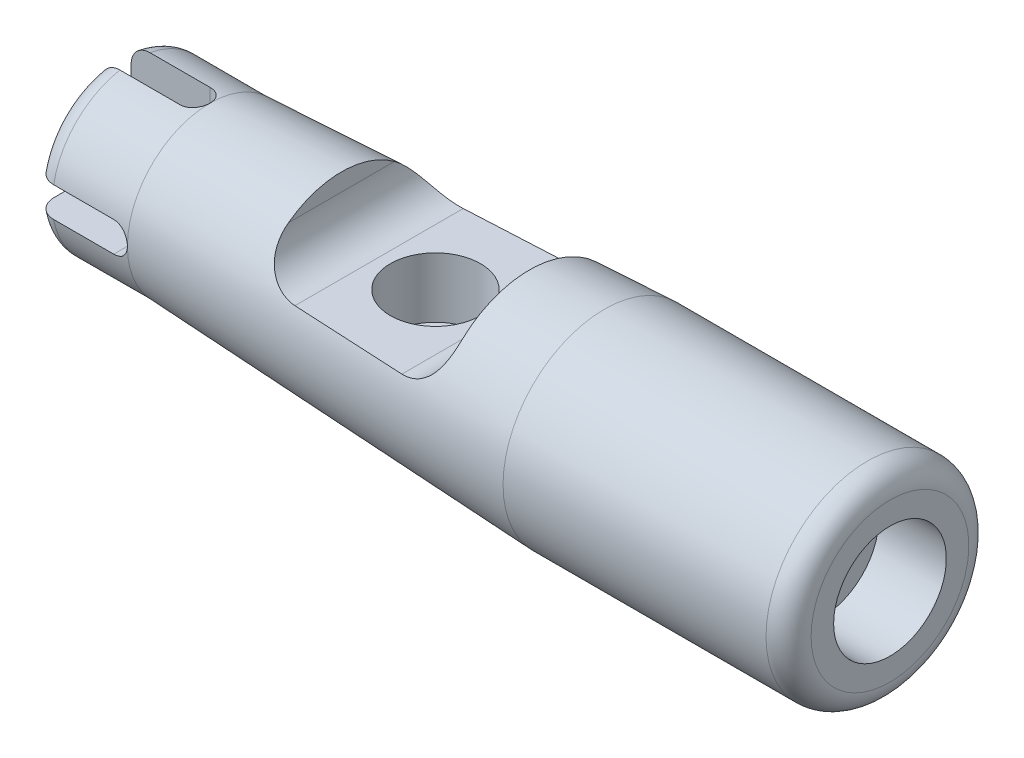
from build123d import *

# Parameters (mm, degrees)
CUT_EXTRUDE_1_DEPTH      = 173.313538512
PATTERN_CIRCULAR_1_COUNT = 4
CUT_EXTRUDE_2_DEPTH      = 173.313538512
CUT_EXTRUDE_2_DEPTH_BACK = 173.313538512
SKETCH_5_R               = 12
CUT_EXTRUDE_3_DEPTH      = 16
CUT_EXTRUDE_4_DEPTH      = 173.313538512
CUT_EXTRUDE_4_DEPTH_BACK = 173.313538512
SKETCH_6_W               = 60
SKETCH_6_H               = 5
SKETCH_7_R               = 3
CUT_EXTRUDE_5_DEPTH      = 12
FILLET_1_R               = 10
FILLET_2_R               = 6
FILLET_3_R               = 5
FILLET_4_R               = 5


with BuildPart() as part:
    # 草圖1 → 旋轉1 (revolve)
    with BuildSketch(Plane.XY, mode=Mode.PRIVATE) as revolve_1_sk:
        Polygon((92.029627014, 27), (-12.970372986, 22), (-37.970372986, 22), (-37.970372986, 0), (-12.970372986, 0), (92.029627014, 0), (168.029627014, 0), (168.029627014, 27), align=None)
    revolve(revolve_1_sk.sketch.rotate(Axis((-42.673460872, 0, 0), (1, 0, 0)), 90), axis=Axis((-42.673460872, 0, 0), (1, 0, 0)))

    # 草圖2 → 除料-伸長1 (cut, through all)
    with BuildSketch(Plane.XY):
        with BuildLine():
            Line((-37.970372986, -4), (-37.970372986, 4))
            Line((-37.970372986, 4), (-16.970372986, 4))
            ThreePointArc((-16.970372986, 4), (-12.970372986, 0), (-16.970372986, -4))
            Line((-16.970372986, -4), (-37.970372986, -4))
        make_face()
    cut_extrude_1 = extrude(amount=-CUT_EXTRUDE_1_DEPTH, mode=Mode.SUBTRACT)

    # 環狀複製排列1: 除料-伸長1 ×4 about axis
    pattern_circular_1_axis = Axis((0, 0, 0), (1, 0, 0))
    for i in range(1, PATTERN_CIRCULAR_1_COUNT):
        add(cut_extrude_1.rotate(pattern_circular_1_axis, i * 360 / PATTERN_CIRCULAR_1_COUNT), mode=Mode.SUBTRACT)

    # 草圖4 → 除料-伸長2 (cut, two sides: drawn at the far end of the back side and taken through both)
    with BuildSketch(Plane.XY.offset(-CUT_EXTRUDE_2_DEPTH_BACK)):
        Polygon((22.029627014, 23.666666667), (22.029627014, 9), (72.029627014, 9), (72.029627014, 26.047619048), align=None)
    extrude(amount=CUT_EXTRUDE_2_DEPTH + CUT_EXTRUDE_2_DEPTH_BACK, mode=Mode.SUBTRACT)

    # 草圖5 → 除料-伸長3 (cut)
    with BuildSketch(Plane(origin=(0, 9, 0), x_dir=(1, 0, 0), z_dir=(0, 1, 0))):
        with Locations(Location((47.029627014, 0, 0), (0, 0, 270))):
            Circle(SKETCH_5_R)
    extrude(amount=-CUT_EXTRUDE_3_DEPTH, mode=Mode.SUBTRACT)

    # 草圖6 → 除料-伸長4 (cut, two sides: drawn at the far end of the back side and taken through both)
    with BuildSketch(Plane.XY.offset(-CUT_EXTRUDE_4_DEPTH_BACK)):
        with Locations((122.029627014, -24.5)):
            Rectangle(SKETCH_6_W, SKETCH_6_H)
    extrude(amount=CUT_EXTRUDE_4_DEPTH + CUT_EXTRUDE_4_DEPTH_BACK, mode=Mode.SUBTRACT)

    # 草圖7 → 除料-伸長5 (cut)
    with BuildSketch(Plane.XZ.offset(22)):
        with Locations(Location((122.029627014, 12, 0), (0, 0, 270))):
            Circle(SKETCH_7_R)
        with Locations(Location((122.029627014, -12, 0), (0, 0, 270))):
            Circle(SKETCH_7_R)
    extrude(amount=-CUT_EXTRUDE_5_DEPTH, mode=Mode.SUBTRACT)

    # 草圖8 → 除料-旋轉1 (revolve, cut)
    with BuildSketch(Plane.XY, mode=Mode.PRIVATE) as cut_revolve_1_sk:
        Polygon((168.029627014, 0), (150.029627014, 0), (130.029627014, 0), (119.637322169, 0), (130.029627014, 6), (150.029627014, 6), (150.029627014, 15), (168.029627014, 15), align=None)
    revolve(cut_revolve_1_sk.sketch.rotate(Axis((-54.560759816, 0, 0), (1, 0, 0)), 270), axis=Axis((-54.560759816, 0, 0), (1, 0, 0)), mode=Mode.SUBTRACT)

    # 圓角1
    fillet_1_edges = [part.edges().sort_by_distance(p)[0] for p in [
        (22.029627014, 9, 0),
        (72.029627014, 9, 0),
    ]]
    fillet(fillet_1_edges, radius=FILLET_1_R)

    # 圓角2
    fillet_2_edges = [part.edges().sort_by_distance(p)[0] for p in [
        (168.029627014, 0, -27),
    ]]
    fillet(fillet_2_edges, radius=FILLET_2_R)

    # 圓角3
    fillet_3_edges = [part.edges().sort_by_distance(p)[0] for p in [
        (-37.970372986, -15.556349186, -15.556349186),
        (-37.970372986, -15.556349186, 15.556349186),
        (-37.970372986, 15.556349186, 15.556349186),
        (-37.970372986, 15.556349186, -15.556349186),
    ]]
    fillet(fillet_3_edges, radius=FILLET_3_R)

    # 圓角4
    # the kernel refuses this fillet: 5 mm, written as the material it adds along each edge
    with BuildSketch(Plane(origin=(152.029627014, -22, -28.152475842), x_dir=(-1, 0, 0), z_dir=(0, 0, 1))) as fillet_4_piece_1_section:
        with BuildLine():
            CenterArc((FILLET_4_R, FILLET_4_R), FILLET_4_R, 180, 90)
            Line((0, FILLET_4_R), (0, 0))
            Line((0, 0), (FILLET_4_R, 0))
        make_face()
    fillet_4_piece_1 = extrude(amount=56.304951685, mode=Mode.PRIVATE)
    fillet_4_piece_1 = fillet_4_piece_1 & Plane(origin=(150.845546458, 0, 0), x_dir=(0, 0, 1), z_dir=(-1, 0, 0)) * Cylinder(27, 133, mode=Mode.PRIVATE)
    add(fillet_4_piece_1)
    with BuildSketch(Plane(origin=(92.029627014, -22, 28.152475842), x_dir=(0, -1, 0), z_dir=(0, 0, -1))) as fillet_4_piece_2_section:
        with BuildLine():
            CenterArc((FILLET_4_R, -FILLET_4_R), FILLET_4_R, 90, 90)
            Line((0, -FILLET_4_R), (0, 0))
            Line((0, 0), (FILLET_4_R, 0))
        make_face()
    fillet_4_piece_2 = extrude(amount=56.304951685, mode=Mode.PRIVATE)
    fillet_4_piece_2 = fillet_4_piece_2 & Plane(origin=(93.213697589, 0, 0), x_dir=(0, 0, 1), z_dir=(-1, 0, 0)) * Cylinder(27, 133, mode=Mode.PRIVATE)
    add(fillet_4_piece_2)


solid = part.part
